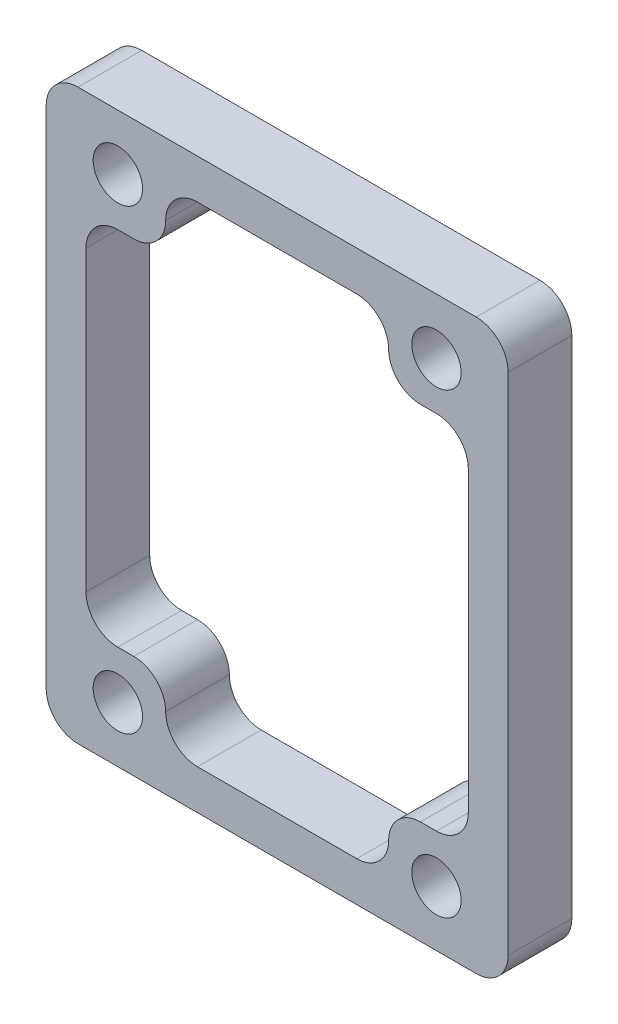
from build123d import *

# Parameters (mm, degrees)
SKETCH_1_W          = 29
SKETCH_1_H          = 35.7
EXTRUDE_1_DEPTH     = 2
SKETCH_2_R          = 1.55
CUT_EXTRUDE_1_DEPTH = 24
SKETCH_4_W          = 24
SKETCH_4_H          = 22.7
CUT_EXTRUDE_2_DEPTH = 10
SKETCH_5_W          = 14
SKETCH_5_H          = 30.7
CUT_EXTRUDE_3_DEPTH = 10
FILLET_START        = -2
FILLET_1_DEPTH      = 4
FILLET_1_2_DEPTH    = 4


with BuildPart() as part:
    # 草图1 → 凸台-拉伸1 (new, symmetric)
    with BuildSketch(Plane.XY):
        Rectangle(SKETCH_1_W, SKETCH_1_H)
    extrude(amount=EXTRUDE_1_DEPTH, both=True)

    # 草图2 → 切除-拉伸1 (cut)
    with BuildSketch(Plane.XY.offset(2)):
        with Locations((10, 14.35)):
            Circle(SKETCH_2_R)
        with Locations((10, -14.35)):
            Circle(SKETCH_2_R)
        with Locations((-10, -14.35)):
            Circle(SKETCH_2_R)
        with Locations((-10, 14.35)):
            Circle(SKETCH_2_R)
    extrude(amount=-CUT_EXTRUDE_1_DEPTH, mode=Mode.SUBTRACT)

    # 草图4 → 切除-拉伸2 (cut)
    with BuildSketch(Plane(origin=(0, 0, -2), x_dir=(-1, 0, 0), z_dir=(0, 0, -1))):
        Rectangle(SKETCH_4_W, SKETCH_4_H)
    extrude(amount=-CUT_EXTRUDE_2_DEPTH, mode=Mode.SUBTRACT)

    # 草图5 → 切除-拉伸3 (cut)
    with BuildSketch(Plane(origin=(0, 0, -2), x_dir=(-1, 0, 0), z_dir=(0, 0, -1))):
        Rectangle(SKETCH_5_W, SKETCH_5_H)
    extrude(amount=-CUT_EXTRUDE_3_DEPTH, mode=Mode.SUBTRACT)

    # 圆角1: read off the stored shape, not the designer's step
    # 圆角1 outline → 圆角1 (cut)
    with BuildSketch(Plane.XY.offset(FILLET_START)):
        with BuildLine():
            Line((14.5, -17.85), (14.5, -15.85))
            ThreePointArc((14.5, -15.85), (13.914213562, -17.264213562), (12.5, -17.85))
            Line((12.5, -17.85), (14.5, -17.85))
        make_face()
        with BuildLine():
            ThreePointArc((12.5, 17.85), (13.914213562, 17.264213562), (14.5, 15.85))
            Line((14.5, 15.85), (14.5, 17.85))
            Line((14.5, 17.85), (12.5, 17.85))
        make_face()
        with BuildLine():
            Line((-14.5, -17.85), (-12.5, -17.85))
            ThreePointArc((-12.5, -17.85), (-13.914213562, -17.264213562), (-14.5, -15.85))
            Line((-14.5, -15.85), (-14.5, -17.85))
        make_face()
        with BuildLine():
            ThreePointArc((-14.5, 15.85), (-13.914213562, 17.264213562), (-12.5, 17.85))
            Line((-12.5, 17.85), (-14.5, 17.85))
            Line((-14.5, 17.85), (-14.5, 15.85))
        make_face()
        with BuildLine():
            ThreePointArc((7, -13.35), (7.585786438, -11.935786438), (9, -11.35))
            Line((9, -11.35), (7, -11.35))
            Line((7, -11.35), (7, -13.35))
        make_face()
        with BuildLine():
            ThreePointArc((-9, -11.35), (-7.585786438, -11.935786438), (-7, -13.35))
            Line((-7, -13.35), (-7, -11.35))
            Line((-7, -11.35), (-9, -11.35))
        make_face()
        with BuildLine():
            Line((7, 11.35), (9, 11.35))
            ThreePointArc((9, 11.35), (7.585786438, 11.935786438), (7, 13.35))
            Line((7, 13.35), (7, 11.35))
        make_face()
        with BuildLine():
            Line((-7, 11.35), (-7, 13.35))
            ThreePointArc((-7, 13.35), (-7.585786438, 11.935786438), (-9, 11.35))
            Line((-9, 11.35), (-7, 11.35))
        make_face()
    extrude(amount=FILLET_1_DEPTH, mode=Mode.SUBTRACT)

    # Fillet 1 2 outline → Fillet 1 2 (add)
    with BuildSketch(Plane.XY.offset(FILLET_START)):
        with BuildLine():
            Line((7, -15.35), (7, -13.35))
            ThreePointArc((7, -13.35), (6.414213562, -14.764213562), (5, -15.35))
            Line((5, -15.35), (7, -15.35))
        make_face()
        with BuildLine():
            ThreePointArc((12, -9.35), (11.414213562, -10.764213562), (10, -11.35))
            Line((10, -11.35), (12, -11.35))
            Line((12, -11.35), (12, -9.35))
        make_face()
        with BuildLine():
            Line((-7, -15.35), (-5, -15.35))
            ThreePointArc((-5, -15.35), (-6.414213562, -14.764213562), (-7, -13.35))
            Line((-7, -13.35), (-7, -15.35))
        make_face()
        with BuildLine():
            ThreePointArc((10, 11.35), (11.414213562, 10.764213562), (12, 9.35))
            Line((12, 9.35), (12, 11.35))
            Line((12, 11.35), (10, 11.35))
        make_face()
        with BuildLine():
            Line((-12, -11.35), (-10, -11.35))
            ThreePointArc((-10, -11.35), (-11.414213562, -10.764213562), (-12, -9.35))
            Line((-12, -9.35), (-12, -11.35))
        make_face()
        with BuildLine():
            ThreePointArc((5, 15.35), (6.414213562, 14.764213562), (7, 13.35))
            Line((7, 13.35), (7, 15.35))
            Line((7, 15.35), (5, 15.35))
        make_face()
        with BuildLine():
            Line((-12, 11.35), (-12, 9.35))
            ThreePointArc((-12, 9.35), (-11.414213562, 10.764213562), (-10, 11.35))
            Line((-10, 11.35), (-12, 11.35))
        make_face()
        with BuildLine():
            ThreePointArc((-7, 13.35), (-6.414213562, 14.764213562), (-5, 15.35))
            Line((-5, 15.35), (-7, 15.35))
            Line((-7, 15.35), (-7, 13.35))
        make_face()
    extrude(amount=FILLET_1_2_DEPTH)


solid = part.part
